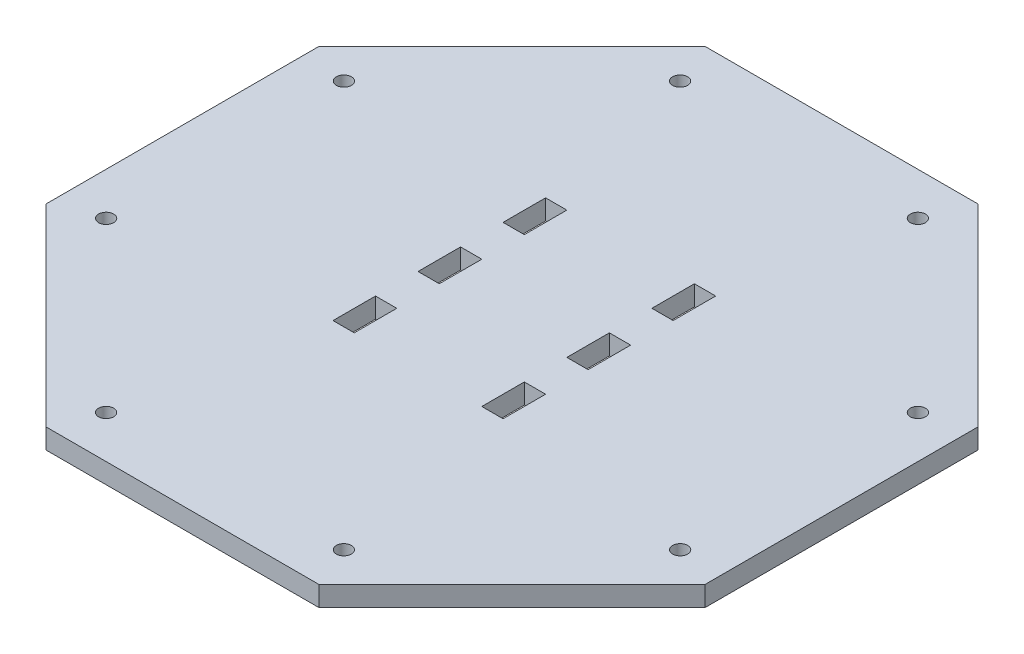
from build123d import *

# Parameters (mm, degrees)
BASE_DEPTH         = 5.9944
MOUNTING_HOLES_D   = 4.4958
SKETCH5_W          = 6.35
SKETCH5_H          = 12.7
CUT_EXTRUDE1_DEPTH = 140.322984756


with BuildPart() as part:
    # Sketch1 → Base (new body)
    with BuildSketch(Plane(origin=(0, 0, 0), x_dir=(1, 0, 0), z_dir=(0, 1, 0))):
        Polygon((-40.768969877, 98.425), (-98.425, 40.768969877), (-98.425, -40.768969877), (-40.768969877, -98.425), (40.768969877, -98.425), (98.425, -40.768969877), (98.425, 40.768969877), (40.768969877, 98.425), align=None)
    extrude(amount=BASE_DEPTH)

    # Mounting holes (through all)
    with Locations(Plane(origin=(0, 5.9944, 0), x_dir=(1, 0, 0), z_dir=(0, 1, 0))):
        with Locations((-35.508457634, 85.725), (35.508457634, 85.725), (85.725, 35.508457634), (85.725, -35.508457634), (35.508457634, -85.725), (-35.508457634, -85.725), (-85.725, -35.508457634), (-85.725, 35.508457634)):
            Hole(MOUNTING_HOLES_D / 2)

    # Sketch5 → Cut-Extrude1 (cut, through all)
    with BuildSketch(Plane(origin=(0, 5.9944, 0), x_dir=(1, 0, 0), z_dir=(0, 1, 0))):
        with Locations((-22.225, 3.683)):
            Rectangle(SKETCH5_W, SKETCH5_H)
        with Locations((-22.225, 29.083)):
            Rectangle(SKETCH5_W, SKETCH5_H)
        with Locations((-22.225, -21.717)):
            Rectangle(SKETCH5_W, SKETCH5_H)
        with Locations((22.225, -21.717)):
            Rectangle(SKETCH5_W, SKETCH5_H)
        with Locations((22.225, 3.683)):
            Rectangle(SKETCH5_W, SKETCH5_H)
        with Locations((22.225, 29.083)):
            Rectangle(SKETCH5_W, SKETCH5_H)
    extrude(amount=-CUT_EXTRUDE1_DEPTH, mode=Mode.SUBTRACT)


solid = part.part
